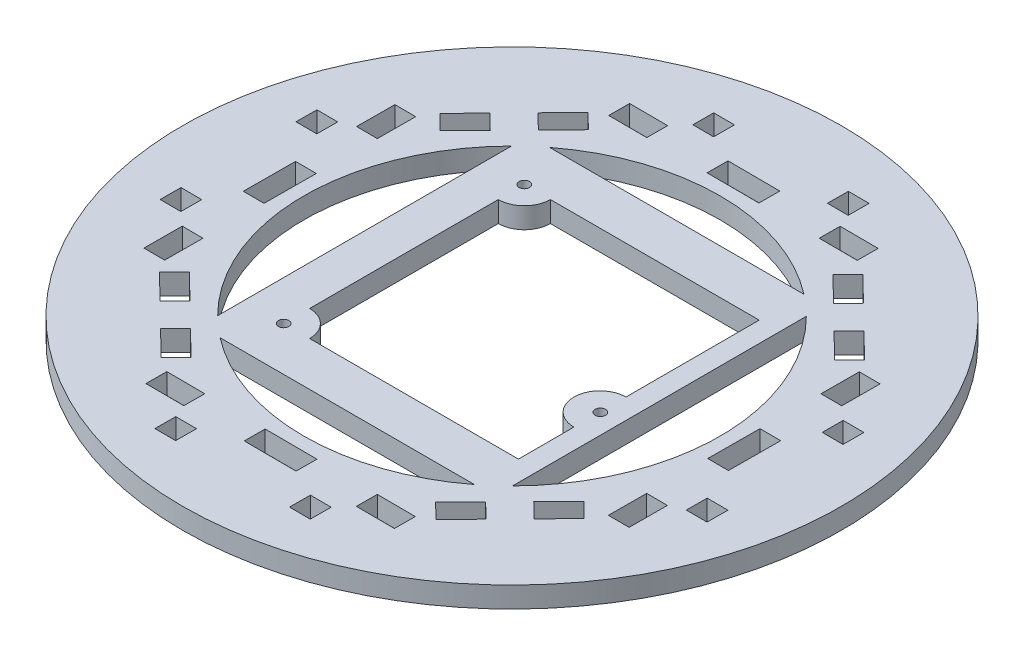
from build123d import *

# Parameters (mm, degrees)
SKETCH1_R             = 95
BOSS_EXTRUDE1_DEPTH   = 6
SKETCH2_W             = 55
SKETCH2_H             = 30
CUT_EXTRUDE1_DEPTH    = 135.484199815
CAVITY1_START         = -69.821849164
CAVITY1_OUTLINE_W     = 15
CAVITY1_OUTLINE_H     = 6
CAVITY1_OUTLINE_W_2   = 11
CAVITY1_DEPTH         = 6
CAVITY1_START_2       = 63.821772898
CAVITY1_2_OUTLINE_W   = 11
CAVITY1_2_OUTLINE_H   = 6
CAVITY1_2_OUTLINE_W_2 = 15
CAVITY1_2_DEPTH       = 6
CAVITY1_START_3       = -7.051829773
CAVITY1_3_OUTLINE_W   = 6
CAVITY1_3_OUTLINE_H   = 6
CAVITY1_3_DEPTH       = 14.103659546
CAVITY1_START_4       = -35.551829773
CAVITY1_4_OUTLINE_W   = 6
CAVITY1_4_OUTLINE_H   = 6
CAVITY1_4_DEPTH       = 10.103659546
CAVITY1_START_5       = 25.448170227
CAVITY1_5_OUTLINE_W   = 6
CAVITY1_5_OUTLINE_H   = 6
CAVITY1_5_DEPTH       = 10.103659546
CAVITY1_START_6       = -36.448170227
CAVITY1_6_OUTLINE_W   = 6
CAVITY1_6_OUTLINE_H   = 6
CAVITY1_6_DEPTH       = 0.896340454
CAVITY1_START_7       = -25.448170227
CAVITY1_7_OUTLINE_W   = 6
CAVITY1_7_OUTLINE_H   = 6
CAVITY1_7_DEPTH       = 0.896340454
CAVITY1_START_8       = -7.948170227
CAVITY1_8_OUTLINE_W   = 6
CAVITY1_8_OUTLINE_H   = 6
CAVITY1_8_DEPTH       = 0.896340454
CAVITY1_START_9       = 7.051829773
CAVITY1_9_OUTLINE_W   = 6
CAVITY1_9_OUTLINE_H   = 6
CAVITY1_9_DEPTH       = 0.896340454
CAVITY1_START_10      = 24.551829773
CAVITY1_10_OUTLINE_W  = 6
CAVITY1_10_OUTLINE_H  = 6
CAVITY1_10_DEPTH      = 0.896340454
CAVITY1_START_11      = 35.551829773
CAVITY1_11_OUTLINE_W  = 6
CAVITY1_11_OUTLINE_H  = 6
CAVITY1_11_DEPTH      = 0.896340454
SKETCH3_R             = 1.5
CUT_EXTRUDE3_DEPTH    = 10
CUT_EXTRUDE4_DEPTH    = 135.484199815
CAVITY2_START         = 73.692998072
CAVITY2_OUTLINE_W     = 6
CAVITY2_OUTLINE_H     = 6
CAVITY2_DEPTH         = 6
CUT_EXTRUDE5_DEPTH    = 135.484199815


# Read off the part's stored shape, not the designer's step: Cavity1, Cavity2
with BuildPart() as part:
    # Sketch1 → Boss-Extrude1 (new body)
    with BuildSketch(Plane(origin=(0, 0, 0), x_dir=(1, 0, 0), z_dir=(0, 1, 0))):
        with Locations(Location((0, 0, 0), (0, 0, 270))):
            Circle(SKETCH1_R)
        with BuildLine():
            Line((-36.657195747, -47.5), (36.657195747, -47.5))
            ThreePointArc((36.657195747, -47.5), (0, -60), (-36.657195747, -47.5))
        make_face(mode=Mode.SUBTRACT)
        with BuildLine():
            Line((-42.5, 42.352685865), (-42.5, -42.352685865))
            ThreePointArc((-42.5, -42.352685865), (-60, 0), (-42.5, 42.352685865))
        make_face(mode=Mode.SUBTRACT)
        with BuildLine():
            Line((36.657195747, 47.5), (-36.657195747, 47.5))
            ThreePointArc((-36.657195747, 47.5), (0, 60), (36.657195747, 47.5))
        make_face(mode=Mode.SUBTRACT)
        with BuildLine():
            Line((42.5, -42.352685865), (42.5, 42.352685865))
            ThreePointArc((42.5, 42.352685865), (60, 0), (42.5, -42.352685865))
        make_face(mode=Mode.SUBTRACT)
    extrude(amount=BOSS_EXTRUDE1_DEPTH)

    # Sketch2 → Cut-Extrude1 (cut, through all)
    with BuildSketch(Plane(origin=(0, 6, 0), x_dir=(1, 0, 0), z_dir=(0, 1, 0))):
        Rectangle(SKETCH2_W, SKETCH2_H)
    extrude(amount=-CUT_EXTRUDE1_DEPTH, mode=Mode.SUBTRACT)

    # Cavity1 outline → Cavity1 (cut)
    with BuildSketch(Plane(origin=(0, 0, 0), x_dir=(0.9999872892756082, 0, 0.005041952719030872), z_dir=(0.005041952719030872, 0, -0.9999872892756083)).offset(CAVITY1_START)):
        with Locations((0.448170227, -3)):
            Rectangle(CAVITY1_OUTLINE_W, CAVITY1_OUTLINE_H)
        with Locations((30.948170227, -3)):
            Rectangle(CAVITY1_OUTLINE_W_2, CAVITY1_OUTLINE_H)
        with Locations((-30.051829773, -3)):
            Rectangle(CAVITY1_OUTLINE_W_2, CAVITY1_OUTLINE_H)
    extrude(amount=CAVITY1_DEPTH, mode=Mode.SUBTRACT)

    # Cavity1 2 outline → Cavity1 2 (cut)
    with BuildSketch(Plane(origin=(0, 0, 0), x_dir=(0.9999872892756082, 0, 0.005041952719030872), z_dir=(0.005041952719030872, 0, -0.9999872892756083)).offset(CAVITY1_START_2)):
        with Locations((30.051829773, -3)):
            Rectangle(CAVITY1_2_OUTLINE_W, CAVITY1_2_OUTLINE_H)
        with Locations((-0.448170227, -3)):
            Rectangle(CAVITY1_2_OUTLINE_W_2, CAVITY1_2_OUTLINE_H)
        with Locations((-30.948170227, -3)):
            Rectangle(CAVITY1_2_OUTLINE_W, CAVITY1_2_OUTLINE_H)
    extrude(amount=CAVITY1_2_DEPTH, mode=Mode.SUBTRACT)

    # Cavity1 3 outline → Cavity1 3 (cut)
    with BuildSketch(Plane(origin=(0, 0, 0), x_dir=(0.9999872892756082, 0, 0.005041952719030872), z_dir=(0.005041952719030872, 0, -0.9999872892756083)).offset(CAVITY1_START_3)):
        with Locations((66.821849164, -3)):
            Rectangle(CAVITY1_3_OUTLINE_W, CAVITY1_3_OUTLINE_H)
        with Locations((-66.821849164, -3)):
            Rectangle(CAVITY1_3_OUTLINE_W, CAVITY1_3_OUTLINE_H)
    extrude(amount=CAVITY1_3_DEPTH, mode=Mode.SUBTRACT)

    # Cavity1 4 outline → Cavity1 4 (cut)
    with BuildSketch(Plane(origin=(0, 0, 0), x_dir=(0.9999872892756082, 0, 0.005041952719030872), z_dir=(0.005041952719030872, 0, -0.9999872892756083)).offset(CAVITY1_START_4)):
        with Locations((66.821849164, -3)):
            Rectangle(CAVITY1_4_OUTLINE_W, CAVITY1_4_OUTLINE_H)
        with Locations((-66.821849164, -3)):
            Rectangle(CAVITY1_4_OUTLINE_W, CAVITY1_4_OUTLINE_H)
    extrude(amount=CAVITY1_4_DEPTH, mode=Mode.SUBTRACT)

    # Cavity1 5 outline → Cavity1 5 (cut)
    with BuildSketch(Plane(origin=(0, 0, 0), x_dir=(0.9999872892756082, 0, 0.005041952719030872), z_dir=(0.005041952719030872, 0, -0.9999872892756083)).offset(CAVITY1_START_5)):
        with Locations((66.821849164, -3)):
            Rectangle(CAVITY1_5_OUTLINE_W, CAVITY1_5_OUTLINE_H)
        with Locations((-66.821849164, -3)):
            Rectangle(CAVITY1_5_OUTLINE_W, CAVITY1_5_OUTLINE_H)
    extrude(amount=CAVITY1_5_DEPTH, mode=Mode.SUBTRACT)

    # Cavity1 6 outline → Cavity1 6 (cut)
    with BuildSketch(Plane(origin=(0, 0, 0), x_dir=(0.9999872892756082, 0, 0.005041952719030872), z_dir=(0.005041952719030872, 0, -0.9999872892756083)).offset(CAVITY1_START_6)):
        with Locations((-66.821849164, -3)):
            Rectangle(CAVITY1_6_OUTLINE_W, CAVITY1_6_OUTLINE_H)
    extrude(amount=CAVITY1_6_DEPTH, mode=Mode.SUBTRACT)

    # Cavity1 7 outline → Cavity1 7 (cut)
    with BuildSketch(Plane(origin=(0, 0, 0), x_dir=(0.9999872892756082, 0, 0.005041952719030872), z_dir=(0.005041952719030872, 0, -0.9999872892756083)).offset(CAVITY1_START_7)):
        with Locations((66.821849164, -3)):
            Rectangle(CAVITY1_7_OUTLINE_W, CAVITY1_7_OUTLINE_H)
    extrude(amount=CAVITY1_7_DEPTH, mode=Mode.SUBTRACT)

    # Cavity1 8 outline → Cavity1 8 (cut)
    with BuildSketch(Plane(origin=(0, 0, 0), x_dir=(0.9999872892756082, 0, 0.005041952719030872), z_dir=(0.005041952719030872, 0, -0.9999872892756083)).offset(CAVITY1_START_8)):
        with Locations((-66.821849164, -3)):
            Rectangle(CAVITY1_8_OUTLINE_W, CAVITY1_8_OUTLINE_H)
    extrude(amount=CAVITY1_8_DEPTH, mode=Mode.SUBTRACT)

    # Cavity1 9 outline → Cavity1 9 (cut)
    with BuildSketch(Plane(origin=(0, 0, 0), x_dir=(0.9999872892756082, 0, 0.005041952719030872), z_dir=(0.005041952719030872, 0, -0.9999872892756083)).offset(CAVITY1_START_9)):
        with Locations((66.821849164, -3)):
            Rectangle(CAVITY1_9_OUTLINE_W, CAVITY1_9_OUTLINE_H)
    extrude(amount=CAVITY1_9_DEPTH, mode=Mode.SUBTRACT)

    # Cavity1 10 outline → Cavity1 10 (cut)
    with BuildSketch(Plane(origin=(0, 0, 0), x_dir=(0.9999872892756082, 0, 0.005041952719030872), z_dir=(0.005041952719030872, 0, -0.9999872892756083)).offset(CAVITY1_START_10)):
        with Locations((-66.821849164, -3)):
            Rectangle(CAVITY1_10_OUTLINE_W, CAVITY1_10_OUTLINE_H)
    extrude(amount=CAVITY1_10_DEPTH, mode=Mode.SUBTRACT)

    # Cavity1 11 outline → Cavity1 11 (cut)
    with BuildSketch(Plane(origin=(0, 0, 0), x_dir=(0.9999872892756082, 0, 0.005041952719030872), z_dir=(0.005041952719030872, 0, -0.9999872892756083)).offset(CAVITY1_START_11)):
        with Locations((66.821849164, -3)):
            Rectangle(CAVITY1_11_OUTLINE_W, CAVITY1_11_OUTLINE_H)
    extrude(amount=CAVITY1_11_DEPTH, mode=Mode.SUBTRACT)

    # Sketch3 → Cut-Extrude3 (cut)
    with BuildSketch(Plane(origin=(0, 6, 0), x_dir=(1, 0, 0), z_dir=(0, 1, 0))):
        with Locations(Location((-31.04, -34.8, 0), (0, 0, 270))):
            Circle(SKETCH3_R)
        with Locations(Location((-31.04, 34.6, 0), (0, 0, 270))):
            Circle(SKETCH3_R)
        with Locations(Location((36.78, -11.31, 0), (0, 0, 270))):
            Circle(SKETCH3_R)
        with BuildLine():
            ThreePointArc((36.657195747, -18.81), (29.157195747, -11.31), (36.657195747, -3.81))
            Line((36.657195747, -3.81), (36.657195747, 34.6))
            Line((36.657195747, 34.6), (-23.54, 34.6))
            ThreePointArc((-23.54, 34.6), (-25.736699141, 29.296699141), (-31.04, 27.1))
            Line((-31.04, 27.1), (-31.04, -27.3))
            ThreePointArc((-31.04, -27.3), (-25.736699141, -29.496699141), (-23.54, -34.8))
            Line((-23.54, -34.8), (36.657195747, -34.8))
            Line((36.657195747, -34.8), (36.657195747, -18.81))
        make_face()
    extrude(amount=-CUT_EXTRUDE3_DEPTH, mode=Mode.SUBTRACT)

    # Sketch4 → Cut-Extrude4 (cut, through all)
    with BuildSketch(Plane(origin=(0, 6, 0), x_dir=(1, 0, 0), z_dir=(0, 1, 0))):
        Polygon((39.849101937, -61.771443224), (35.488287493, -57.506083054), (42.620529088, -50.214229392), (46.981343533, -54.479589562), align=None)
        Polygon((53.83388938, -47.473690947), (60.966130976, -40.181837285), (56.605316531, -35.916477115), (49.473074935, -43.208330777), align=None)
        Polygon((-61.771443224, -39.849101937), (-57.506083054, -35.488287493), (-50.214229392, -42.620529088), (-54.479589562, -46.981343533), align=None)
        Polygon((-47.473690947, -53.83388938), (-43.208330777, -49.473074935), (-35.916477115, -56.605316531), (-40.181837285, -60.966130976), align=None)
        Polygon((-39.849101937, 61.771443224), (-35.488287493, 57.506083054), (-42.620529088, 50.214229392), (-46.981343533, 54.479589562), align=None)
        Polygon((-53.83388938, 47.473690947), (-49.473074935, 43.208330777), (-56.605316531, 35.916477115), (-60.966130976, 40.181837285), align=None)
        Polygon((61.771443224, 39.849101937), (57.506083054, 35.488287493), (50.214229392, 42.620529088), (54.479589562, 46.981343533), align=None)
        Polygon((47.473690947, 53.83388938), (43.208330777, 49.473074935), (35.916477115, 56.605316531), (40.181837285, 60.966130976), align=None)
    extrude(amount=-CUT_EXTRUDE4_DEPTH, mode=Mode.SUBTRACT)

    # Cavity2 outline → Cavity2 (cut)
    with BuildSketch(Plane(origin=(0, 0, 0), x_dir=(0, 1, 0), z_dir=(0.9999872892756082, 0, 0.005041952719040901)).offset(CAVITY2_START)):
        with Locations((3, -19.041827)):
            Rectangle(CAVITY2_OUTLINE_W, CAVITY2_OUTLINE_H)
        with Locations((3, 19.958173)):
            Rectangle(CAVITY2_OUTLINE_W, CAVITY2_OUTLINE_H)
    extrude(amount=CAVITY2_DEPTH, mode=Mode.SUBTRACT)

    # Sketch5 → Cut-Extrude5 (cut, through all)
    with BuildSketch(Plane(origin=(0, 6, 0), x_dir=(1, 0, 0), z_dir=(0, 1, 0))):
        Polygon((15.670066484, -73.772943514), (21.66999022, -73.80319523), (21.639738504, -79.803118966), (15.639814768, -79.77286725), align=None)
        Polygon((-23.329437797, -73.576307358), (-23.359689514, -79.576231094), (-17.359765778, -79.60648281), (-17.329514062, -73.606559074), align=None)
        Polygon((-73.772943514, -15.670066484), (-73.80319523, -21.66999022), (-79.803118966, -21.639738504), (-79.77286725, -15.639814768), align=None)
        Polygon((-73.576307358, 23.329437797), (-79.576231094, 23.359689514), (-79.60648281, 17.359765778), (-73.606559074, 17.329514062), align=None)
        Polygon((-15.670066484, 73.772943514), (-21.66999022, 73.80319523), (-21.639738504, 79.803118966), (-15.639814768, 79.77286725), align=None)
        Polygon((23.329437797, 73.576307358), (23.359689514, 79.576231094), (17.359765778, 79.60648281), (17.329514062, 73.606559074), align=None)
    extrude(amount=-CUT_EXTRUDE5_DEPTH, mode=Mode.SUBTRACT)


solid = part.part
